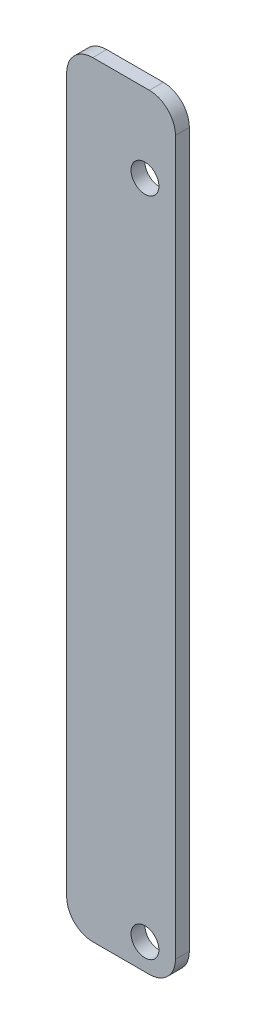
from build123d import *

# Parameters (mm, degrees)
SKETCH2_W                      = 12.5
SKETCH2_H                      = 88
BOSS_EXTRUDE1_DEPTH            = 1.6
F_3_2_3_2_DIAMETER_HOLE1_D     = 3.2
F_3_2_3_2_DIAMETER_HOLE1_DEPTH = 1.6
F_3_2_3_2_DIAMETER_HOLE1_TIP   = 0.96137699
FILLET1_R                      = 3


with BuildPart() as part:
    # Sketch2 → Boss-Extrude1 (new body)
    with BuildSketch(Plane.XY):
        with Locations((-53.102520427, -5.981220417)):
            Rectangle(SKETCH2_W, SKETCH2_H)
    extrude(amount=BOSS_EXTRUDE1_DEPTH)

    # Ø3.2 (3.2) Diameter Hole1
    with Locations(Plane.XY.offset(1.6)):
        with Locations((-50.352520427, 29.018779583), (-50.352520427, -46.981220417)):
            Hole(F_3_2_3_2_DIAMETER_HOLE1_D / 2, depth=F_3_2_3_2_DIAMETER_HOLE1_DEPTH)
            with Locations((0, 0, -(F_3_2_3_2_DIAMETER_HOLE1_DEPTH + F_3_2_3_2_DIAMETER_HOLE1_TIP / 2))):  # 118° drill point
                Cone(0, F_3_2_3_2_DIAMETER_HOLE1_D / 2, F_3_2_3_2_DIAMETER_HOLE1_TIP, mode=Mode.SUBTRACT)

    # Fillet1
    fillet1_edges = [part.edges().sort_by_distance(p)[0] for p in [
        (-46.852520427, 38.018779583, 0.8),
        (-59.352520427, 38.018779583, 0.8),
        (-46.852520427, -49.981220417, 0.8),
        (-59.352520427, -49.981220417, 0.8),
    ]]
    fillet(fillet1_edges, radius=FILLET1_R)


solid = part.part
